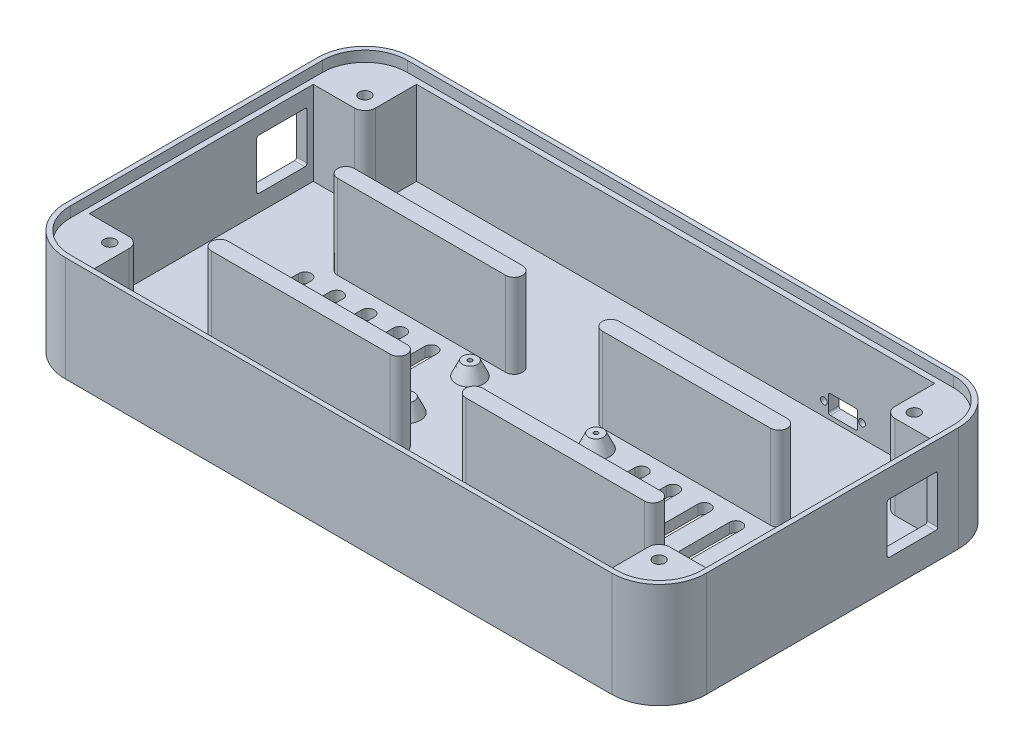
from build123d import *
from OCP.BRepFilletAPI import BRepFilletAPI_MakeChamfer

# Parameters (mm, degrees)
SKETCH_1_W                   = 305
SKETCH_1_H                   = 165
EXTRUDE_1_DEPTH              = 50
FILLET_1_R                   = 22.5
SHELL_1_T                    = -5
CUT_EXTRUDE_1_DEPTH          = 5
EXTRUDE_START                = 40
SKETCH_6_R                   = 2.75
EXTRUDE_3_DEPTH              = 40
FILLET_2_R                   = 5
CUT_EXTRUDE_2_DEPTH          = 320.892560089
CUT_EXTRUDE_2_DEPTH_BACK     = 320.892560089
SKETCH_7_W                   = 24
SKETCH_7_H                   = 24
SKETCH_8_R                   = 1.6
SKETCH_8_W                   = 14
SKETCH_8_H                   = 9
CUT_EXTRUDE_3_DEPTH          = 5
EXTRUDE_4_DEPTH              = 40
SKETCH_10_R                  = 3.5
SKETCH_10_R_2                = 1
EXTRUDE_5_DEPTH              = 6.5
CUT_EXTRUDE_START            = -2.5
SKETCH_11_R                  = 1
CUT_EXTRUDE_4_DEPTH          = 2.5
CUT_EXTRUDE_5_REACH          = 181.13
CUT_EXTRUDE_6_REACH          = 181.13
SKETCH_13_R                  = 1.6
HOLE_WIZARD_M3_1_D           = 3.6
HOLE_WIZARD_M3_1_DEPTH       = 10
HOLE_WIZARD_M3_1_CSINK_D     = 6.8
HOLE_WIZARD_M3_1_CSINK_ANGLE = 90
HOLE_WIZARD_M3_1_TIP         = 1.081549114
CHAMFER_2_SIZE               = 3
CHAMFER_2_SIZE_2             = 6.5
FILLET_3_R                   = 1
FILLET_4_R                   = 1


with BuildPart() as part:
    # 草图1 → 凸台-拉伸1 (new body)
    with BuildSketch(Plane(origin=(0, 0, 0), x_dir=(1, 0, 0), z_dir=(0, 1, 0))):
        Rectangle(SKETCH_1_W, SKETCH_1_H)
    extrude(amount=EXTRUDE_1_DEPTH)

    # 圆角1
    fillet_1_edges = [part.edges().sort_by_distance(p)[0] for p in [
        (152.5, 25, 82.5),
        (-152.5, 25, 82.5),
        (-152.5, 25, -82.5),
        (152.5, 25, -82.5),
    ]]
    fillet(fillet_1_edges, radius=FILLET_1_R)

    # 抽壳1
    shell_1_openings = [part.faces().sort_by_distance(p)[0] for p in [
        (0, 50, 0),
    ]]
    offset(amount=SHELL_1_T, openings=shell_1_openings, kind=Kind.INTERSECTION)

    # 草图5 → 切除-拉伸1 (cut)
    with BuildSketch(Plane(origin=(0, 50, 0), x_dir=(1, 0, 0), z_dir=(0, 1, 0))):
        with BuildLine():
            Line((130, 80.2), (-130, 80.2))
            ThreePointArc((-130, 80.2), (-144.28355698, 74.28355698), (-150.2, 60))
            Line((-150.2, 60), (-150.2, -60))
            ThreePointArc((-150.2, -60), (-144.28355698, -74.28355698), (-130, -80.2))
            Line((-130, -80.2), (130, -80.2))
            ThreePointArc((130, -80.2), (144.28355698, -74.28355698), (150.2, -60))
            Line((150.2, -60), (150.2, 60))
            ThreePointArc((150.2, 60), (144.28355698, 74.28355698), (130, 80.2))
        make_face()
        with BuildLine():
            Line((-147.5, 60), (-147.5, -60))
            ThreePointArc((-147.5, -60), (-142.374368671, -72.374368671), (-130, -77.5))
            Line((-130, -77.5), (130, -77.5))
            ThreePointArc((130, -77.5), (142.374368671, -72.374368671), (147.5, -60))
            Line((147.5, -60), (147.5, 60))
            ThreePointArc((147.5, 60), (142.374368671, 72.374368671), (130, 77.5))
            Line((130, 77.5), (-130, 77.5))
            ThreePointArc((-130, 77.5), (-142.374368671, 72.374368671), (-147.5, 60))
        make_face(mode=Mode.SUBTRACT)
    extrude(amount=-CUT_EXTRUDE_1_DEPTH, mode=Mode.SUBTRACT)

    # 草图6 → 凸台-拉伸3 (add)
    # profile 1 of 4: a face of its own
    with BuildSketch(Plane(origin=(0, 5, 0), x_dir=(1, 0, 0), z_dir=(0, 1, 0)).offset(EXTRUDE_START)):
        with BuildLine():
            Line((130, 77.5), (123.636038969, 77.5))
            Line((123.636038969, 77.5), (123.636038969, 53.636038969))
            Line((123.636038969, 53.636038969), (147.5, 53.636038969))
            Line((147.5, 53.636038969), (147.5, 60))
            ThreePointArc((147.5, 60), (142.374368671, 72.374368671), (130, 77.5))
        make_face()
        with Locations(Location((130.707106781, 60.707106781, 0), (0, 0, 270))):
            Circle(SKETCH_6_R, mode=Mode.SUBTRACT)
    # profile 2 of 4: a face of its own
    with BuildSketch(Plane(origin=(0, 5, 0), x_dir=(1, 0, 0), z_dir=(0, 1, 0)).offset(EXTRUDE_START)):
        with BuildLine():
            Line((122.928932188, -52.928932188), (122.928932188, -77.5))
            Line((122.928932188, -77.5), (130, -77.5))
            ThreePointArc((130, -77.5), (142.374368671, -72.374368671), (147.5, -60))
            Line((147.5, -60), (147.5, -52.928932188))
            Line((147.5, -52.928932188), (122.928932188, -52.928932188))
        make_face()
        with Locations(Location((130.707106781, -60.707106781, 0), (0, 0, 270))):
            Circle(SKETCH_6_R, mode=Mode.SUBTRACT)
    # profile 3 of 4: a face of its own
    with BuildSketch(Plane(origin=(0, 5, 0), x_dir=(1, 0, 0), z_dir=(0, 1, 0)).offset(EXTRUDE_START)):
        with BuildLine():
            Line((-123.636038969, -53.636038969), (-147.5, -53.636038969))
            Line((-147.5, -53.636038969), (-147.5, -60))
            ThreePointArc((-147.5, -60), (-142.374368671, -72.374368671), (-130, -77.5))
            Line((-130, -77.5), (-123.636038969, -77.5))
            Line((-123.636038969, -77.5), (-123.636038969, -53.636038969))
        make_face()
        with Locations(Location((-130.707106781, -60.707106781, 0), (0, 0, 270))):
            Circle(SKETCH_6_R, mode=Mode.SUBTRACT)
    # profile 4 of 4: a face of its own
    with BuildSketch(Plane(origin=(0, 5, 0), x_dir=(1, 0, 0), z_dir=(0, 1, 0)).offset(EXTRUDE_START)):
        with BuildLine():
            Line((-147.5, 60), (-147.5, 52.928932188))
            Line((-147.5, 52.928932188), (-122.928932188, 52.928932188))
            Line((-122.928932188, 52.928932188), (-122.928932188, 77.5))
            Line((-122.928932188, 77.5), (-130, 77.5))
            ThreePointArc((-130, 77.5), (-142.374368671, 72.374368671), (-147.5, 60))
        make_face()
        with Locations(Location((-130.707106781, 60.707106781, 0), (0, 0, 270))):
            Circle(SKETCH_6_R, mode=Mode.SUBTRACT)
    extrude(amount=-EXTRUDE_3_DEPTH)

    # 圆角2
    fillet_2_edges = [part.edges().sort_by_distance(p)[0] for p in [
        (123.636038969, 25, -53.636038969),
        (122.928932188, 25, 52.928932188),
        (-123.636038969, 25, 53.636038969),
        (-122.928932188, 25, -52.928932188),
    ]]
    fillet(fillet_2_edges, radius=FILLET_2_R)

    # 草图7 → 切除-拉伸2 (cut, two sides: drawn at the far end of the back side and taken through both)
    with BuildSketch(Plane.ZY.offset(152.5).offset(-CUT_EXTRUDE_2_DEPTH_BACK)):
        with Locations((-38, 25)):
            Rectangle(SKETCH_7_W, SKETCH_7_H)
    extrude(amount=CUT_EXTRUDE_2_DEPTH + CUT_EXTRUDE_2_DEPTH_BACK, mode=Mode.SUBTRACT)

    # 草图8 → 切除-拉伸3 (cut)
    with BuildSketch(Plane(origin=(0, 0, -82.5), x_dir=(-1, 0, 0), z_dir=(0, 0, -1))):
        with Locations((-89.1, 11.5)):
            Circle(SKETCH_8_R)
        with Locations((-70.9, 11.5)):
            Circle(SKETCH_8_R)
        with Locations((-80, 11.5)):
            Rectangle(SKETCH_8_W, SKETCH_8_H)
    extrude(amount=-CUT_EXTRUDE_3_DEPTH, mode=Mode.SUBTRACT)

    # 草图9 → 凸台-拉伸4 (add)
    with BuildSketch(Plane(origin=(0, 5, 0), x_dir=(1, 0, 0), z_dir=(0, 1, 0))):
        with BuildLine():
            Line((-103, 28), (-23, 28))
            ThreePointArc((-23, 28), (-19, 24), (-23, 20))
            Line((-23, 20), (-103, 20))
            ThreePointArc((-103, 20), (-107, 24), (-103, 28))
        make_face()
        with BuildLine():
            Line((103, 28), (23, 28))
            ThreePointArc((23, 28), (19, 24), (23, 20))
            Line((23, 20), (103, 20))
            ThreePointArc((103, 20), (107, 24), (103, 28))
        make_face()
        with BuildLine():
            Line((-103, -32), (-18, -32))
            ThreePointArc((-18, -32), (-14, -36), (-18, -40))
            Line((-18, -40), (-103, -40))
            ThreePointArc((-103, -40), (-107, -36), (-103, -32))
        make_face()
        with BuildLine():
            Line((103, -32), (18, -32))
            ThreePointArc((18, -32), (14, -36), (18, -40))
            Line((18, -40), (103, -40))
            ThreePointArc((103, -40), (107, -36), (103, -32))
        make_face()
    extrude(amount=EXTRUDE_4_DEPTH)

    # 草图10 → 凸台-拉伸5 (add)
    # profile 1 of 4: a face of its own
    with BuildSketch(Plane(origin=(0, 5, 0), x_dir=(1, 0, 0), z_dir=(0, 1, 0))):
        with Locations(Location((-30, -20, 0), (0, 0, 90))):
            Circle(SKETCH_10_R)
        with Locations(Location((-30, -20, 0), (0, 0, 90))):
            Circle(SKETCH_10_R_2, mode=Mode.SUBTRACT)
    # profile 2 of 4: a face of its own
    with BuildSketch(Plane(origin=(0, 5, 0), x_dir=(1, 0, 0), z_dir=(0, 1, 0))):
        with Locations(Location((-30, 10, 0), (0, 0, 90))):
            Circle(SKETCH_10_R)
        with Locations(Location((-30, 10, 0), (0, 0, 90))):
            Circle(SKETCH_10_R_2, mode=Mode.SUBTRACT)
    # profile 3 of 4: a face of its own
    with BuildSketch(Plane(origin=(0, 5, 0), x_dir=(1, 0, 0), z_dir=(0, 1, 0))):
        with Locations(Location((30, 10, 0), (0, 0, 90))):
            Circle(SKETCH_10_R)
        with Locations(Location((30, 10, 0), (0, 0, 90))):
            Circle(SKETCH_10_R_2, mode=Mode.SUBTRACT)
    # profile 4 of 4: a face of its own
    with BuildSketch(Plane(origin=(0, 5, 0), x_dir=(1, 0, 0), z_dir=(0, 1, 0))):
        with Locations(Location((30, -20, 0), (0, 0, 90))):
            Circle(SKETCH_10_R)
        with Locations(Location((30, -20, 0), (0, 0, 90))):
            Circle(SKETCH_10_R_2, mode=Mode.SUBTRACT)
    extrude(amount=EXTRUDE_5_DEPTH)

    # 草图11 → 切除-拉伸4 (cut)
    with BuildSketch(Plane(origin=(0, 5, 0), x_dir=(1, 0, 0), z_dir=(0, 1, 0)).offset(CUT_EXTRUDE_START)):
        with Locations(Location((30, 10, 0), (0, 0, 90))):
            Circle(SKETCH_11_R)
        with Locations(Location((30, -20, 0), (0, 0, 90))):
            Circle(SKETCH_11_R)
        with Locations(Location((-30, -20, 0), (0, 0, 90))):
            Circle(SKETCH_11_R)
        with Locations(Location((-30, 10, 0), (0, 0, 90))):
            Circle(SKETCH_11_R)
    extrude(amount=CUT_EXTRUDE_4_DEPTH, mode=Mode.SUBTRACT)

    # 草图12 → 切除-拉伸5 (cut, up to next)
    with BuildSketch(Plane(origin=(0, 5, 0), x_dir=(1, 0, 0), z_dir=(0, 1, 0)), mode=Mode.PRIVATE) as cut_extrude_5_sk1:
        with BuildLine():
            Line((-107, 11.5), (-107, -23.5))
            ThreePointArc((-107, -23.5), (-110, -26.5), (-113, -23.5))
            Line((-113, -23.5), (-113, 11.5))
            ThreePointArc((-113, 11.5), (-110, 14.5), (-107, 11.5))
        make_face()
    cut_extrude_5_tool1 = extrude(cut_extrude_5_sk1.sketch, amount=-CUT_EXTRUDE_5_REACH, mode=Mode.PRIVATE) & part.part
    # 草图12 → 切除-拉伸5 (cut, up to next)
    with BuildSketch(Plane(origin=(0, 5, 0), x_dir=(1, 0, 0), z_dir=(0, 1, 0)), mode=Mode.PRIVATE) as cut_extrude_5_sk2:
        with BuildLine():
            Line((-92, 11.5), (-92, -23.5))
            ThreePointArc((-92, -23.5), (-95, -26.5), (-98, -23.5))
            Line((-98, -23.5), (-98, 11.5))
            ThreePointArc((-98, 11.5), (-95, 14.5), (-92, 11.5))
        make_face()
    cut_extrude_5_tool2 = extrude(cut_extrude_5_sk2.sketch, amount=-CUT_EXTRUDE_5_REACH, mode=Mode.PRIVATE) & part.part
    # 草图12 → 切除-拉伸5 (cut, up to next)
    with BuildSketch(Plane(origin=(0, 5, 0), x_dir=(1, 0, 0), z_dir=(0, 1, 0)), mode=Mode.PRIVATE) as cut_extrude_5_sk3:
        with BuildLine():
            Line((-77, 11.5), (-77, -23.5))
            ThreePointArc((-77, -23.5), (-80, -26.5), (-83, -23.5))
            Line((-83, -23.5), (-83, 11.5))
            ThreePointArc((-83, 11.5), (-80, 14.5), (-77, 11.5))
        make_face()
    cut_extrude_5_tool3 = extrude(cut_extrude_5_sk3.sketch, amount=-CUT_EXTRUDE_5_REACH, mode=Mode.PRIVATE) & part.part
    # 草图12 → 切除-拉伸5 (cut, up to next)
    with BuildSketch(Plane(origin=(0, 5, 0), x_dir=(1, 0, 0), z_dir=(0, 1, 0)), mode=Mode.PRIVATE) as cut_extrude_5_sk4:
        with BuildLine():
            Line((-62, 11.5), (-62, -23.5))
            ThreePointArc((-62, -23.5), (-65, -26.5), (-68, -23.5))
            Line((-68, -23.5), (-68, 11.5))
            ThreePointArc((-68, 11.5), (-65, 14.5), (-62, 11.5))
        make_face()
    cut_extrude_5_tool4 = extrude(cut_extrude_5_sk4.sketch, amount=-CUT_EXTRUDE_5_REACH, mode=Mode.PRIVATE) & part.part
    # 草图12 → 切除-拉伸5 (cut, up to next)
    with BuildSketch(Plane(origin=(0, 5, 0), x_dir=(1, 0, 0), z_dir=(0, 1, 0)), mode=Mode.PRIVATE) as cut_extrude_5_sk5:
        with BuildLine():
            Line((-47, 11.5), (-47, -23.5))
            ThreePointArc((-47, -23.5), (-50, -26.5), (-53, -23.5))
            Line((-53, -23.5), (-53, 11.5))
            ThreePointArc((-53, 11.5), (-50, 14.5), (-47, 11.5))
        make_face()
    cut_extrude_5_tool5 = extrude(cut_extrude_5_sk5.sketch, amount=-CUT_EXTRUDE_5_REACH, mode=Mode.PRIVATE) & part.part
    # 草图12 → 切除-拉伸5 (cut, up to next)
    with BuildSketch(Plane(origin=(0, 5, 0), x_dir=(1, 0, 0), z_dir=(0, 1, 0)), mode=Mode.PRIVATE) as cut_extrude_5_sk6:
        with BuildLine():
            Line((107, 11.5), (107, -23.5))
            ThreePointArc((107, -23.5), (110, -26.5), (113, -23.5))
            Line((113, -23.5), (113, 11.5))
            ThreePointArc((113, 11.5), (110, 14.5), (107, 11.5))
        make_face()
    cut_extrude_5_tool6 = extrude(cut_extrude_5_sk6.sketch, amount=-CUT_EXTRUDE_5_REACH, mode=Mode.PRIVATE) & part.part
    # 草图12 → 切除-拉伸5 (cut, up to next)
    with BuildSketch(Plane(origin=(0, 5, 0), x_dir=(1, 0, 0), z_dir=(0, 1, 0)), mode=Mode.PRIVATE) as cut_extrude_5_sk7:
        with BuildLine():
            Line((92, 11.5), (92, -23.5))
            ThreePointArc((92, -23.5), (95, -26.5), (98, -23.5))
            Line((98, -23.5), (98, 11.5))
            ThreePointArc((98, 11.5), (95, 14.5), (92, 11.5))
        make_face()
    cut_extrude_5_tool7 = extrude(cut_extrude_5_sk7.sketch, amount=-CUT_EXTRUDE_5_REACH, mode=Mode.PRIVATE) & part.part
    # 草图12 → 切除-拉伸5 (cut, up to next)
    with BuildSketch(Plane(origin=(0, 5, 0), x_dir=(1, 0, 0), z_dir=(0, 1, 0)), mode=Mode.PRIVATE) as cut_extrude_5_sk8:
        with BuildLine():
            Line((77, 11.5), (77, -23.5))
            ThreePointArc((77, -23.5), (80, -26.5), (83, -23.5))
            Line((83, -23.5), (83, 11.5))
            ThreePointArc((83, 11.5), (80, 14.5), (77, 11.5))
        make_face()
    cut_extrude_5_tool8 = extrude(cut_extrude_5_sk8.sketch, amount=-CUT_EXTRUDE_5_REACH, mode=Mode.PRIVATE) & part.part
    # 草图12 → 切除-拉伸5 (cut, up to next)
    with BuildSketch(Plane(origin=(0, 5, 0), x_dir=(1, 0, 0), z_dir=(0, 1, 0)), mode=Mode.PRIVATE) as cut_extrude_5_sk9:
        with BuildLine():
            Line((62, 11.5), (62, -23.5))
            ThreePointArc((62, -23.5), (65, -26.5), (68, -23.5))
            Line((68, -23.5), (68, 11.5))
            ThreePointArc((68, 11.5), (65, 14.5), (62, 11.5))
        make_face()
    cut_extrude_5_tool9 = extrude(cut_extrude_5_sk9.sketch, amount=-CUT_EXTRUDE_5_REACH, mode=Mode.PRIVATE) & part.part
    # 草图12 → 切除-拉伸5 (cut, up to next)
    with BuildSketch(Plane(origin=(0, 5, 0), x_dir=(1, 0, 0), z_dir=(0, 1, 0)), mode=Mode.PRIVATE) as cut_extrude_5_sk10:
        with BuildLine():
            Line((47, 11.5), (47, -23.5))
            ThreePointArc((47, -23.5), (50, -26.5), (53, -23.5))
            Line((53, -23.5), (53, 11.5))
            ThreePointArc((53, 11.5), (50, 14.5), (47, 11.5))
        make_face()
    cut_extrude_5_tool10 = extrude(cut_extrude_5_sk10.sketch, amount=-CUT_EXTRUDE_5_REACH, mode=Mode.PRIVATE) & part.part
    add(cut_extrude_5_tool1.solids().sort_by_distance((-110, 5, 6))[0], mode=Mode.SUBTRACT)
    add(cut_extrude_5_tool2.solids().sort_by_distance((-95, 5, 6))[0], mode=Mode.SUBTRACT)
    add(cut_extrude_5_tool3.solids().sort_by_distance((-80, 5, 6))[0], mode=Mode.SUBTRACT)
    add(cut_extrude_5_tool4.solids().sort_by_distance((-65, 5, 6))[0], mode=Mode.SUBTRACT)
    add(cut_extrude_5_tool5.solids().sort_by_distance((-50, 5, 6))[0], mode=Mode.SUBTRACT)
    add(cut_extrude_5_tool6.solids().sort_by_distance((110, 5, 6))[0], mode=Mode.SUBTRACT)
    add(cut_extrude_5_tool7.solids().sort_by_distance((95, 5, 6))[0], mode=Mode.SUBTRACT)
    add(cut_extrude_5_tool8.solids().sort_by_distance((80, 5, 6))[0], mode=Mode.SUBTRACT)
    add(cut_extrude_5_tool9.solids().sort_by_distance((65, 5, 6))[0], mode=Mode.SUBTRACT)
    add(cut_extrude_5_tool10.solids().sort_by_distance((50, 5, 6))[0], mode=Mode.SUBTRACT)

    # 草图13 → 切除-拉伸6 (cut, up to next)
    with BuildSketch(Plane(origin=(0, 5, 0), x_dir=(1, 0, 0), z_dir=(0, 1, 0)), mode=Mode.PRIVATE) as cut_extrude_6_sk1:
        with Locations(Location((-17.5, 62.45, 0), (0, 0, 270))):
            Circle(SKETCH_13_R)
    cut_extrude_6_tool1 = extrude(cut_extrude_6_sk1.sketch, amount=-CUT_EXTRUDE_6_REACH, mode=Mode.PRIVATE) & part.part
    # 草图13 → 切除-拉伸6 (cut, up to next)
    with BuildSketch(Plane(origin=(0, 5, 0), x_dir=(1, 0, 0), z_dir=(0, 1, 0)), mode=Mode.PRIVATE) as cut_extrude_6_sk2:
        with Locations(Location((17.5, 62.45, 0), (0, 0, 270))):
            Circle(SKETCH_13_R)
    cut_extrude_6_tool2 = extrude(cut_extrude_6_sk2.sketch, amount=-CUT_EXTRUDE_6_REACH, mode=Mode.PRIVATE) & part.part
    # 草图13 → 切除-拉伸6 (cut, up to next)
    with BuildSketch(Plane(origin=(0, 5, 0), x_dir=(1, 0, 0), z_dir=(0, 1, 0)), mode=Mode.PRIVATE) as cut_extrude_6_sk3:
        with Locations(Location((0, 50.95, 0), (0, 0, 270))):
            Circle(SKETCH_13_R)
    cut_extrude_6_tool3 = extrude(cut_extrude_6_sk3.sketch, amount=-CUT_EXTRUDE_6_REACH, mode=Mode.PRIVATE) & part.part
    add(cut_extrude_6_tool1.solids().sort_by_distance((-17.5, 5, -62.45))[0], mode=Mode.SUBTRACT)
    add(cut_extrude_6_tool2.solids().sort_by_distance((17.5, 5, -62.45))[0], mode=Mode.SUBTRACT)
    add(cut_extrude_6_tool3.solids().sort_by_distance((0, 5, -50.95))[0], mode=Mode.SUBTRACT)

    # M3 平头机械螺钉的锥形沉头孔1
    with Locations(Plane(origin=(0, 0, 0), x_dir=(-1, 0, 0), z_dir=(0, -1, 0))):
        with Locations((-17.5, 62.45), (0, 50.95), (17.5, 62.45)):
            CounterSinkHole(HOLE_WIZARD_M3_1_D / 2, HOLE_WIZARD_M3_1_CSINK_D / 2, depth=HOLE_WIZARD_M3_1_DEPTH, counter_sink_angle=HOLE_WIZARD_M3_1_CSINK_ANGLE)
            with Locations((0, 0, -(HOLE_WIZARD_M3_1_DEPTH + HOLE_WIZARD_M3_1_TIP / 2))):  # 118° drill point
                Cone(0, HOLE_WIZARD_M3_1_D / 2, HOLE_WIZARD_M3_1_TIP, mode=Mode.SUBTRACT)

    # 倒角2
    chamfer_2_edges_1 = [part.edges().sort_by_distance(p)[0] for p in [
        (-30, 5, 23.5),
    ]]
    chamfer_2_side_1 = [part.faces().sort_by_distance(p)[0] for p in [
        (-30, 5, 23.56),
    ]]
    chamfer_2_edges_2 = [part.edges().sort_by_distance(p)[0] for p in [
        (-30, 5, -6.5),
    ]]
    chamfer_2_side_2 = [part.faces().sort_by_distance(p)[0] for p in [
        (-30, 5, -6.44),
    ]]
    chamfer_2_edges_3 = [part.edges().sort_by_distance(p)[0] for p in [
        (30, 5, -6.5),
    ]]
    chamfer_2_side_3 = [part.faces().sort_by_distance(p)[0] for p in [
        (30, 5, -6.44),
    ]]
    chamfer_2_edges_4 = [part.edges().sort_by_distance(p)[0] for p in [
        (30, 5, 23.5),
    ]]
    chamfer_2_side_4 = [part.faces().sort_by_distance(p)[0] for p in [
        (30, 5, 23.56),
    ]]
    chamfer_2 = BRepFilletAPI_MakeChamfer(part.part.solid().wrapped)
    for e in chamfer_2_edges_1:
        chamfer_2.Add(CHAMFER_2_SIZE - 0.0001, CHAMFER_2_SIZE_2 - 0.0001, e.wrapped, chamfer_2_side_1[0].wrapped)
    for e in chamfer_2_edges_2:
        chamfer_2.Add(CHAMFER_2_SIZE - 0.0001, CHAMFER_2_SIZE_2 - 0.0001, e.wrapped, chamfer_2_side_2[0].wrapped)
    for e in chamfer_2_edges_3:
        chamfer_2.Add(CHAMFER_2_SIZE - 0.0001, CHAMFER_2_SIZE_2 - 0.0001, e.wrapped, chamfer_2_side_3[0].wrapped)
    for e in chamfer_2_edges_4:
        chamfer_2.Add(CHAMFER_2_SIZE - 0.0001, CHAMFER_2_SIZE_2 - 0.0001, e.wrapped, chamfer_2_side_4[0].wrapped)
    add(Compound.cast(chamfer_2.Shape()), mode=Mode.REPLACE)  # a hair under: the kernel refuses the full size

    # 圆角3
    fillet_3_edges = [part.edges().sort_by_distance(p)[0] for p in [
        (73, 16, -80),
        (73, 7, -80),
        (87, 7, -80),
        (87, 16, -80),
    ]]
    fillet(fillet_3_edges, radius=FILLET_3_R)

    # 圆角4
    fillet_4_edges = [part.edges().sort_by_distance(p)[0] for p in [
        (-150, 13, -50),
        (150, 13, -50),
        (-150, 37, -50),
        (150, 37, -50),
        (-150, 37, -26),
        (150, 37, -26),
        (-150, 13, -26),
        (150, 13, -26),
    ]]
    fillet(fillet_4_edges, radius=FILLET_4_R)


solid = part.part
